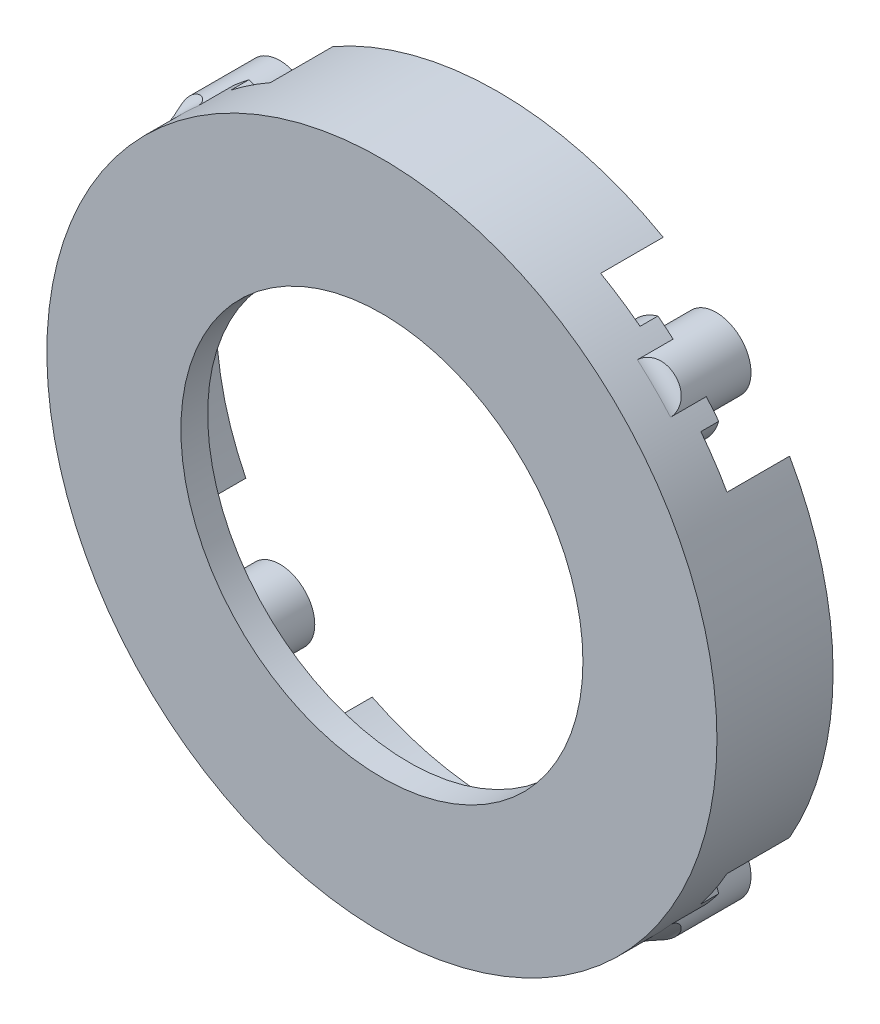
from build123d import *
from build123d.topology import SkipClean

# Parameters (mm, degrees)
SKETCH1_R           = 37.5
SKETCH1_R_2         = 31.55
BOSS_EXTRUDE3_DEPTH = 13
BOSS_EXTRUDE4_START = -3
SKETCH3_R           = 31.55
SKETCH3_R_2         = 22.5
BOSS_EXTRUDE4_DEPTH = 3
CUT_EXTRUDE1_DEPTH  = 7
SKETCH5_R           = 3.9
BOSS_EXTRUDE5_DEPTH = 7
FILLET1_R           = 2
BOSS_EXTRUDE6_START = 2
BOSS_EXTRUDE6_DEPTH = 2


with BuildPart() as part:
    # Sketch1 → Boss-Extrude3 (new body)
    with BuildSketch(Plane.XY):
        with Locations(Location((0, 0, 0), (0, 0, 180))):
            Circle(SKETCH1_R)
        with Locations(Location((0, 0, 0), (0, 0, 180))):
            Circle(SKETCH1_R_2, mode=Mode.SUBTRACT)
    extrude(amount=BOSS_EXTRUDE3_DEPTH)

    # Sketch3 → Boss-Extrude4 (add)
    with BuildSketch(Plane.XY.offset(13).offset(BOSS_EXTRUDE4_START)):
        with Locations(Location((0, 0, 0), (0, 0, 180))):
            Circle(SKETCH3_R)
        Circle(SKETCH3_R_2, mode=Mode.SUBTRACT)
    extrude(amount=BOSS_EXTRUDE4_DEPTH)

    # Sketch4 → Cut-Extrude1 (cut)
    with BuildSketch(Plane(origin=(0, 0, 0), x_dir=(-1, 0, 0), z_dir=(0, 0, -1))):
        with BuildLine():
            Line((14.042596771, 28.184732394), (18.485242563, 32.627378187))
            ThreePointArc((18.485242563, 32.627378187), (26.516504294, 26.516504294), (32.627378187, 18.485242563))
            Line((32.627378187, 18.485242563), (28.184732394, 14.042596771))
            ThreePointArc((28.184732394, 14.042596771), (22.266271176, 22.266271176), (14.042596771, 28.184732394))
        make_face()
        with BuildLine():
            Line((-28.184732394, 14.042596771), (-32.627378187, 18.485242563))
            ThreePointArc((-32.627378187, 18.485242563), (-26.516504294, 26.516504294), (-18.485242563, 32.627378187))
            Line((-18.485242563, 32.627378187), (-14.042596771, 28.184732394))
            ThreePointArc((-14.042596771, 28.184732394), (-22.266271176, 22.266271176), (-28.184732394, 14.042596771))
        make_face()
        with BuildLine():
            Line((28.184732394, -14.042596771), (32.627378187, -18.485242563))
            ThreePointArc((32.627378187, -18.485242563), (26.516504294, -26.516504294), (18.485242563, -32.627378187))
            Line((18.485242563, -32.627378187), (14.042596771, -28.184732394))
            ThreePointArc((14.042596771, -28.184732394), (22.266271176, -22.266271176), (28.184732394, -14.042596771))
        make_face()
        with BuildLine():
            Line((-14.042596771, -28.184732394), (-18.485242563, -32.627378187))
            ThreePointArc((-18.485242563, -32.627378187), (-26.516504294, -26.516504294), (-32.627378187, -18.485242563))
            Line((-32.627378187, -18.485242563), (-28.184732394, -14.042596771))
            ThreePointArc((-28.184732394, -14.042596771), (-22.266271176, -22.266271176), (-14.042596771, -28.184732394))
        make_face()
    extrude(amount=-CUT_EXTRUDE1_DEPTH, mode=Mode.SUBTRACT)

    # Sketch5 → Boss-Extrude5 (add)
    with BuildSketch(Plane(origin=(0, 0, 7), x_dir=(-1, 0, 0), z_dir=(0, 0, -1))):
        with Locations(Location((-24.41286162, 24.41286162, 0), (0, 0, 177.336210289))):
            Circle(SKETCH5_R)
        with Locations(Location((24.41286162, 24.41286162, 0), (0, 0, 186.853632151))):
            Circle(SKETCH5_R)
        with Locations(Location((24.41286162, -24.41286162, 0), (0, 0, 173.146367849))):
            Circle(SKETCH5_R)
        with Locations(Location((-24.41286162, -24.41286162, 0), (0, 0, 182.663789711))):
            Circle(SKETCH5_R)
    extrude(amount=BOSS_EXTRUDE5_DEPTH)

    # Fillet1
    # the kernel refuses this fillet: 2 mm, written as the material it adds along each edge
    with BuildSketch(Plane(origin=(0, 0, 7), x_dir=(0.8522672417072393, -0.5231066322584089, 0), z_dir=(0.5231066322584089, 0.8522672417072393, 0))) as fillet1_piece_1_section:
        with BuildLine():
            CenterArc((31.55 - FILLET1_R, -FILLET1_R), FILLET1_R, 0, 90)
            Line((31.55 - FILLET1_R, 0), (31.55 - FILLET1_R, FILLET1_R * 0.02))
            Line((31.55 - FILLET1_R, FILLET1_R * 0.02), (31.55 + FILLET1_R * 0.02, FILLET1_R * 0.02))
            Line((31.55 + FILLET1_R * 0.02, FILLET1_R * 0.02), (31.55 + FILLET1_R * 0.02, -FILLET1_R))
            Line((31.55 + FILLET1_R * 0.02, -FILLET1_R), (31.55, -FILLET1_R))
        make_face()
    fillet1_piece_1 = revolve(axis=Axis((0, 0, 7), (0, 0, -1)), revolution_arc=26.918260189, mode=Mode.PRIVATE)
    fillet1_piece_1 = split(fillet1_piece_1, bisect_by=Plane(origin=(22.123120479, -22.123120561, 7), z_dir=(0, 0, 1)), keep=Keep.TOP, mode=Mode.PRIVATE)
    fillet1_piece_1 = fillet1_piece_1 & Plane(origin=(24.41286162, -24.41286162, 7.600786832), x_dir=(0.9989194462244536, -0.046475154164681974, 0), z_dir=(0, 0, 1)) * Cylinder(3.9, 127, mode=Mode.PRIVATE)
    add(fillet1_piece_1)
    with BuildSketch(Plane(origin=(0, 0, 7), x_dir=(-0.5231066322587135, -0.8522672417070523, 0), z_dir=(0.8522672417070523, -0.5231066322587135, 0))) as fillet1_piece_2_section:
        with BuildLine():
            CenterArc((31.55 - FILLET1_R, -FILLET1_R), FILLET1_R, 0, 90)
            Line((31.55 - FILLET1_R, 0), (31.55 - FILLET1_R, FILLET1_R * 0.02))
            Line((31.55 - FILLET1_R, FILLET1_R * 0.02), (31.55 + FILLET1_R * 0.02, FILLET1_R * 0.02))
            Line((31.55 + FILLET1_R * 0.02, FILLET1_R * 0.02), (31.55 + FILLET1_R * 0.02, -FILLET1_R))
            Line((31.55 + FILLET1_R * 0.02, -FILLET1_R), (31.55, -FILLET1_R))
        make_face()
    fillet1_piece_2 = revolve(axis=Axis((0, 0, 7), (0, 0, -1)), revolution_arc=26.918260189, mode=Mode.PRIVATE)
    fillet1_piece_2 = split(fillet1_piece_2, bisect_by=Plane(origin=(-22.123120549, -22.123120494, 7), z_dir=(0, 0, 1)), keep=Keep.TOP, mode=Mode.PRIVATE)
    fillet1_piece_2 = fillet1_piece_2 & Plane(origin=(-24.41286162, -24.41286162, 7.600786841), x_dir=(0.9928542401658877, 0.11933338922790077, 0), z_dir=(0, 0, 1)) * Cylinder(3.9, 127, mode=Mode.PRIVATE)
    add(fillet1_piece_2)
    with BuildSketch(Plane(origin=(0, 0, 7), x_dir=(-0.852267241707228, 0.5231066322584271, 0), z_dir=(-0.5231066322584271, -0.852267241707228, 0))) as fillet1_piece_3_section:
        with BuildLine():
            CenterArc((31.55 - FILLET1_R, -FILLET1_R), FILLET1_R, 0, 90)
            Line((31.55 - FILLET1_R, 0), (31.55 - FILLET1_R, FILLET1_R * 0.02))
            Line((31.55 - FILLET1_R, FILLET1_R * 0.02), (31.55 + FILLET1_R * 0.02, FILLET1_R * 0.02))
            Line((31.55 + FILLET1_R * 0.02, FILLET1_R * 0.02), (31.55 + FILLET1_R * 0.02, -FILLET1_R))
            Line((31.55 + FILLET1_R * 0.02, -FILLET1_R), (31.55, -FILLET1_R))
        make_face()
    fillet1_piece_3 = revolve(axis=Axis((0, 0, 7), (0, 0, -1)), revolution_arc=26.918260189, mode=Mode.PRIVATE)
    fillet1_piece_3 = split(fillet1_piece_3, bisect_by=Plane(origin=(-22.12312056, 22.123120602, 7), z_dir=(0, 0, 1)), keep=Keep.TOP, mode=Mode.PRIVATE)
    fillet1_piece_3 = fillet1_piece_3 & Plane(origin=(-24.41286162, 24.41286162, 7.600787298), x_dir=(0.9928542401658879, -0.11933338922790053, 0), z_dir=(0, 0, 1)) * Cylinder(3.9, 127, mode=Mode.PRIVATE)
    add(fillet1_piece_3)
    with BuildSketch(Plane(origin=(0, 0, 7), x_dir=(0.5231066322584331, 0.8522672417072245, 0), z_dir=(-0.8522672417072245, 0.5231066322584331, 0))) as fillet1_piece_4_section:
        with BuildLine():
            CenterArc((31.55 - FILLET1_R, -FILLET1_R), FILLET1_R, 0, 90)
            Line((31.55 - FILLET1_R, 0), (31.55 - FILLET1_R, FILLET1_R * 0.02))
            Line((31.55 - FILLET1_R, FILLET1_R * 0.02), (31.55 + FILLET1_R * 0.02, FILLET1_R * 0.02))
            Line((31.55 + FILLET1_R * 0.02, FILLET1_R * 0.02), (31.55 + FILLET1_R * 0.02, -FILLET1_R))
            Line((31.55 + FILLET1_R * 0.02, -FILLET1_R), (31.55, -FILLET1_R))
        make_face()
    fillet1_piece_4 = revolve(axis=Axis((0, 0, 7), (0, 0, -1)), revolution_arc=26.918260189, mode=Mode.PRIVATE)
    fillet1_piece_4 = split(fillet1_piece_4, bisect_by=Plane(origin=(22.123120561, 22.123120479, 7), z_dir=(0, 0, 1)), keep=Keep.TOP, mode=Mode.PRIVATE)
    fillet1_piece_4 = fillet1_piece_4 & Plane(origin=(24.41286162, 24.41286162, 7.600786832), x_dir=(0.9989194462244536, 0.04647515416468177, 0), z_dir=(0, 0, 1)) * Cylinder(3.9, 127, mode=Mode.PRIVATE)
    add(fillet1_piece_4)
    with BuildSketch(Plane(origin=(0, 0, 7), x_dir=(-0.5496666156121164, 0.8353841102639683, 0), z_dir=(0.8353841102639683, 0.5496666156121164, 0))) as fillet1_piece_5_section:
        with BuildLine():
            CenterArc((37.5 + FILLET1_R, FILLET1_R), FILLET1_R, 180, 90)
            Line((37.5 + FILLET1_R, 0), (37.5 + FILLET1_R, -FILLET1_R * 0.02))
            Line((37.5 + FILLET1_R, -FILLET1_R * 0.02), (37.5 - FILLET1_R * 0.02, -FILLET1_R * 0.02))
            Line((37.5 - FILLET1_R * 0.02, -FILLET1_R * 0.02), (37.5 - FILLET1_R * 0.02, FILLET1_R))
            Line((37.5 - FILLET1_R * 0.02, FILLET1_R), (37.5, FILLET1_R))
        make_face()
    fillet1_piece_5 = revolve(axis=Axis((0, 0, 7), (0, 0, 1)), revolution_arc=23.311711171, mode=Mode.PRIVATE)
    fillet1_piece_5 = split(fillet1_piece_5, bisect_by=Plane(origin=(-26.670763505, 26.670763698, 7), z_dir=(0, 0, 1)), keep=Keep.TOP, mode=Mode.PRIVATE)
    fillet1_piece_5 = fillet1_piece_5 & Plane(origin=(-24.41286162, 24.41286162, 7.599310908), x_dir=(0.9928542401658879, -0.11933338922790053, 0), z_dir=(0, 0, 1)) * Cylinder(3.9, 159, mode=Mode.PRIVATE)
    add(fillet1_piece_5)
    with BuildSketch(Plane(origin=(0, 0, 7), x_dir=(-0.83538411026401, -0.5496666156120531, 0), z_dir=(-0.5496666156120531, 0.83538411026401, 0))) as fillet1_piece_6_section:
        with BuildLine():
            CenterArc((37.5 + FILLET1_R, FILLET1_R), FILLET1_R, 180, 90)
            Line((37.5 + FILLET1_R, 0), (37.5 + FILLET1_R, -FILLET1_R * 0.02))
            Line((37.5 + FILLET1_R, -FILLET1_R * 0.02), (37.5 - FILLET1_R * 0.02, -FILLET1_R * 0.02))
            Line((37.5 - FILLET1_R * 0.02, -FILLET1_R * 0.02), (37.5 - FILLET1_R * 0.02, FILLET1_R))
            Line((37.5 - FILLET1_R * 0.02, FILLET1_R), (37.5, FILLET1_R))
        make_face()
    fillet1_piece_6 = revolve(axis=Axis((0, 0, 7), (0, 0, 1)), revolution_arc=23.311711171, mode=Mode.PRIVATE)
    fillet1_piece_6 = split(fillet1_piece_6, bisect_by=Plane(origin=(-26.670763698, -26.670763505, 7), z_dir=(0, 0, 1)), keep=Keep.TOP, mode=Mode.PRIVATE)
    fillet1_piece_6 = fillet1_piece_6 & Plane(origin=(-24.41286162, -24.41286162, 7.599310908), x_dir=(0.9928542401658877, 0.11933338922790077, 0), z_dir=(0, 0, 1)) * Cylinder(3.9, 159, mode=Mode.PRIVATE)
    add(fillet1_piece_6)
    with BuildSketch(Plane(origin=(0, 0, 7), x_dir=(0.5496666156120977, -0.8353841102639804, 0), z_dir=(-0.8353841102639804, -0.5496666156120977, 0))) as fillet1_piece_7_section:
        with BuildLine():
            CenterArc((37.5 + FILLET1_R, FILLET1_R), FILLET1_R, 180, 90)
            Line((37.5 + FILLET1_R, 0), (37.5 + FILLET1_R, -FILLET1_R * 0.02))
            Line((37.5 + FILLET1_R, -FILLET1_R * 0.02), (37.5 - FILLET1_R * 0.02, -FILLET1_R * 0.02))
            Line((37.5 - FILLET1_R * 0.02, -FILLET1_R * 0.02), (37.5 - FILLET1_R * 0.02, FILLET1_R))
            Line((37.5 - FILLET1_R * 0.02, FILLET1_R), (37.5, FILLET1_R))
        make_face()
    fillet1_piece_7 = revolve(axis=Axis((0, 0, 7), (0, 0, 1)), revolution_arc=23.311711171, mode=Mode.PRIVATE)
    fillet1_piece_7 = split(fillet1_piece_7, bisect_by=Plane(origin=(26.670763696, -26.670763753, 7), z_dir=(0, 0, 1)), keep=Keep.TOP, mode=Mode.PRIVATE)
    fillet1_piece_7 = fillet1_piece_7 & Plane(origin=(24.41286162, -24.41286162, 7.599310071), x_dir=(0.9989194462244536, -0.046475154164681974, 0), z_dir=(0, 0, 1)) * Cylinder(3.9, 159, mode=Mode.PRIVATE)
    add(fillet1_piece_7)
    with BuildSketch(Plane(origin=(0, 0, 7), x_dir=(0.8353841102637132, 0.549666615612504, 0), z_dir=(0.549666615612504, -0.8353841102637132, 0))) as fillet1_piece_8_section:
        with BuildLine():
            CenterArc((37.5 + FILLET1_R, FILLET1_R), FILLET1_R, 180, 90)
            Line((37.5 + FILLET1_R, 0), (37.5 + FILLET1_R, -FILLET1_R * 0.02))
            Line((37.5 + FILLET1_R, -FILLET1_R * 0.02), (37.5 - FILLET1_R * 0.02, -FILLET1_R * 0.02))
            Line((37.5 - FILLET1_R * 0.02, -FILLET1_R * 0.02), (37.5 - FILLET1_R * 0.02, FILLET1_R))
            Line((37.5 - FILLET1_R * 0.02, FILLET1_R), (37.5, FILLET1_R))
        make_face()
    fillet1_piece_8 = revolve(axis=Axis((0, 0, 7), (0, 0, 1)), revolution_arc=23.311711171, mode=Mode.PRIVATE)
    fillet1_piece_8 = split(fillet1_piece_8, bisect_by=Plane(origin=(26.670763736, 26.670763453, 7), z_dir=(0, 0, 1)), keep=Keep.TOP, mode=Mode.PRIVATE)
    fillet1_piece_8 = fillet1_piece_8 & Plane(origin=(24.41286162, 24.41286162, 7.599310915), x_dir=(0.9989194462244536, 0.04647515416468177, 0), z_dir=(0, 0, 1)) * Cylinder(3.9, 159, mode=Mode.PRIVATE)
    add(fillet1_piece_8)

    # Sketch6 → Boss-Extrude6 (add)
    with SkipClean():  # the faces are left unmerged after this step: merging them gives an invalid solid
        with BuildSketch(Plane(origin=(0, 0, 7), x_dir=(-1, 0, 0), z_dir=(0, 0, -1)).offset(BOSS_EXTRUDE6_START)):
            with BuildLine():
                ThreePointArc((-18.970835248, 25.209321887), (-20.271738243, 28.0324054), (-22.895356993, 29.699370838))
                ThreePointArc((-22.895356993, 29.699370838), (-26.516504294, 26.516504294), (-29.699370838, 22.895356993))
                ThreePointArc((-29.699370838, 22.895356993), (-28.0324054, 20.271738243), (-25.209321887, 18.970835248))
                ThreePointArc((-25.209321887, 18.970835248), (-22.309218946, 22.309218946), (-18.970835248, 25.209321887))
            make_face()
            with BuildLine():
                ThreePointArc((25.209321887, 18.970835248), (28.0324054, 20.271738243), (29.699370838, 22.895356993))
                ThreePointArc((29.699370838, 22.895356993), (26.516504294, 26.516504294), (22.895356993, 29.699370838))
                ThreePointArc((22.895356993, 29.699370838), (20.271738243, 28.0324054), (18.970835248, 25.209321887))
                ThreePointArc((18.970835248, 25.209321887), (22.309218946, 22.309218946), (25.209321887, 18.970835248))
            make_face()
            with BuildLine():
                ThreePointArc((18.970835248, -25.209321887), (20.271738243, -28.0324054), (22.895356993, -29.699370838))
                ThreePointArc((22.895356993, -29.699370838), (26.516504294, -26.516504294), (29.699370838, -22.895356993))
                ThreePointArc((29.699370838, -22.895356993), (28.0324054, -20.271738243), (25.209321887, -18.970835248))
                ThreePointArc((25.209321887, -18.970835248), (22.309218946, -22.309218946), (18.970835248, -25.209321887))
            make_face()
            with BuildLine():
                ThreePointArc((-25.209321887, -18.970835248), (-28.0324054, -20.271738243), (-29.699370838, -22.895356993))
                ThreePointArc((-29.699370838, -22.895356993), (-26.516504294, -26.516504294), (-22.895356993, -29.699370838))
                ThreePointArc((-22.895356993, -29.699370838), (-20.271738243, -28.0324054), (-18.970835248, -25.209321887))
                ThreePointArc((-18.970835248, -25.209321887), (-22.309218946, -22.309218946), (-25.209321887, -18.970835248))
            make_face()
        extrude(amount=-BOSS_EXTRUDE6_DEPTH)
    add(part.part.scale(1), mode=Mode.REPLACE)  # the faces are merged on a copy


solid = part.part
